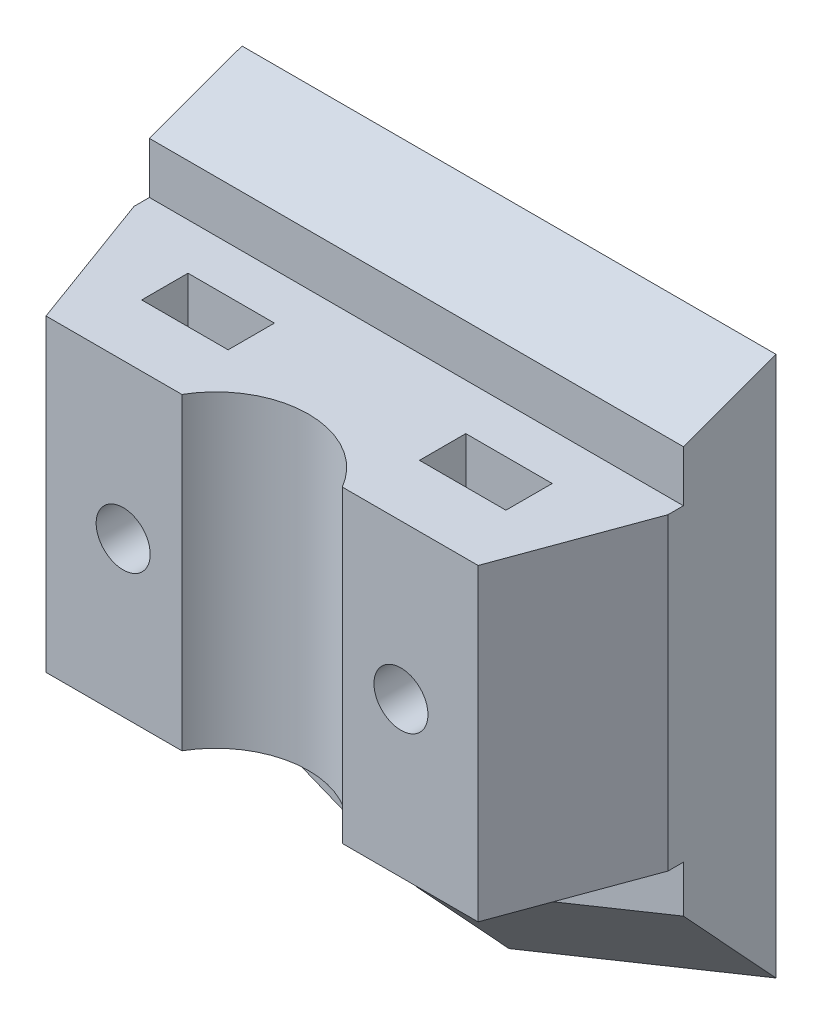
from build123d import *

# Parameters (mm, degrees)
ESBO_O1_W                = 34.6
ESBO_O1_H                = 26
RESSALTO_EXTRUS_O1_DEPTH = 7
ESBO_O10_W               = 34.6
ESBO_O10_H               = 2.5
RESSALTO_EXTRUS_O4_DEPTH = 7
CHANFRO1_SIZE            = 7
CHANFRO2_SIZE2           = 7
CHANFRO2_SIZE            = 2.54779164
ESBO_O11_W               = 5.6
ESBO_O11_H               = 3
RESSALTO_EXTRUS_O5_DEPTH = 10
ESBO_O12_R               = 1.75
CORTE_EXTRUS_O1_DEPTH    = 20
ESBO_O13_W               = 34.6
ESBO_O13_H               = 5.5
ESBO_O13_H_2             = 18.393079324
CORTE_EXTRUS_O2_DEPTH    = 1


with BuildPart() as part:
    # Esboço1 → Ressalto-extrusão1 (new body)
    with BuildSketch(Plane.XY):
        Rectangle(ESBO_O1_W, ESBO_O1_H)
    extrude(amount=RESSALTO_EXTRUS_O1_DEPTH)

    # Esboço10 → Ressalto-extrusão4 (add)
    with BuildSketch(Plane(origin=(0, 0, 0), x_dir=(-1, 0, 0), z_dir=(0, 0, -1))):
        Polygon((-17.3, -19.5), (0, -26.5), (17.3, -19.5), (17.3, -13), (-17.3, -13), align=None)
        with Locations((0, 14.25)):
            Rectangle(ESBO_O10_W, ESBO_O10_H)
    extrude(amount=-RESSALTO_EXTRUS_O4_DEPTH)

    # Chanfro1
    chanfro1_edges = [part.edges().sort_by_distance(p)[0] for p in [
        (8.65, -23, 7),
        (-8.65, -23, 7),
    ]]
    chamfer(chanfro1_edges, length=CHANFRO1_SIZE - 0.0001)  # a hair under: the kernel refuses the full size

    # Chanfro2
    chanfro2_edges = [part.edges().sort_by_distance(p)[0] for p in [
        (0, 15.5, 7),
    ]]
    chanfro2_side = [part.faces().sort_by_distance(p)[0] for p in [
        (0, 15.449044167, 7),
    ]]
    chamfer(chanfro2_edges, length=CHANFRO2_SIZE - 0.0001, length2=CHANFRO2_SIZE2 - 0.0001, reference=chanfro2_side[0])  # a hair under: the kernel refuses the full size

    # Esboço11 → Ressalto-extrusão5 (add, symmetric)
    with BuildSketch(Plane(origin=(0, 0, 0), x_dir=(1, 0, 0), z_dir=(0, 1, 0))):
        with BuildLine():
            Line((-17.3, -7), (-14, -16))
            Line((-14, -16), (-5.196152423, -16))
            ThreePointArc((-5.196152423, -16), (0, -13), (5.196152423, -16))
            Line((5.196152423, -16), (14, -16))
            Line((14, -16), (17.3, -7))
            Line((17.3, -7), (-17.3, -7))
        make_face()
        with Locations((-9, -10.5)):
            Rectangle(ESBO_O11_W, ESBO_O11_H, mode=Mode.SUBTRACT)
        with Locations((9, -10.5)):
            Rectangle(ESBO_O11_W, ESBO_O11_H, mode=Mode.SUBTRACT)
    extrude(amount=RESSALTO_EXTRUS_O5_DEPTH, both=True)

    # Esboço12 → Corte-extrusão1 (cut)
    with BuildSketch(Plane.XY.offset(16)):
        with Locations((-9, 0)):
            Circle(ESBO_O12_R)
        with Locations(Location((9, 0, 0), (0, 0, 180))):
            Circle(ESBO_O12_R)
    extrude(amount=-CORTE_EXTRUS_O1_DEPTH, mode=Mode.SUBTRACT)

    # Esboço13 → Corte-extrusão2 (cut)
    with BuildSketch(Plane.XY.offset(7)):
        with Locations((0, 12.75)):
            Rectangle(ESBO_O13_W, ESBO_O13_H)
        with Locations((0, -19.196539662)):
            Rectangle(ESBO_O13_W, ESBO_O13_H_2)
    extrude(amount=-CORTE_EXTRUS_O2_DEPTH, mode=Mode.SUBTRACT)


solid = part.part
